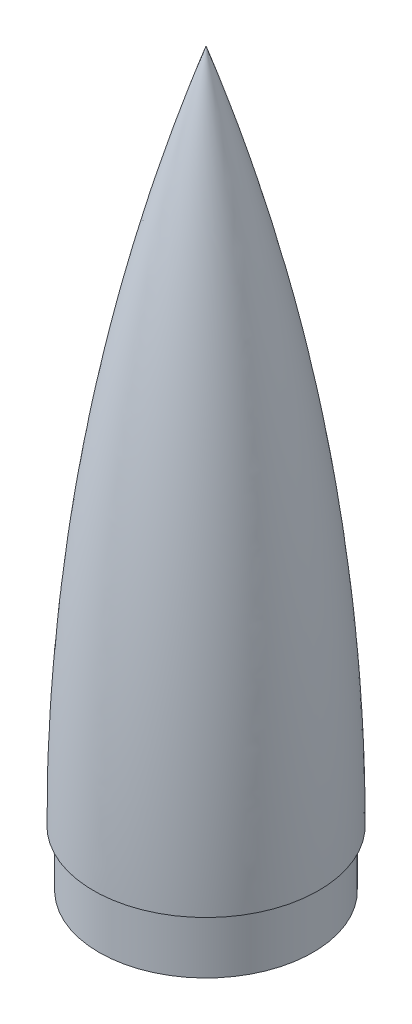
from build123d import *


with BuildPart() as part:
    # Sketch1 → Revolve1 (revolve)
    with BuildSketch(Plane.XY):
        with BuildLine():
            Line((-25.4, 0), (-24.1554, 0))
            Line((-24.1554, 0), (-24.1554, -12.7))
            Line((-24.1554, -12.7), (0, -12.7))
            Line((0, -12.7), (0, 152.4))
            ThreePointArc((0, 152.4), (-19.006504809, 77.251084135), (-25.4, 0))
        make_face()
    revolve(axis=Axis((0, -12.7, 0), (0, 1, 0)))


solid = part.part
